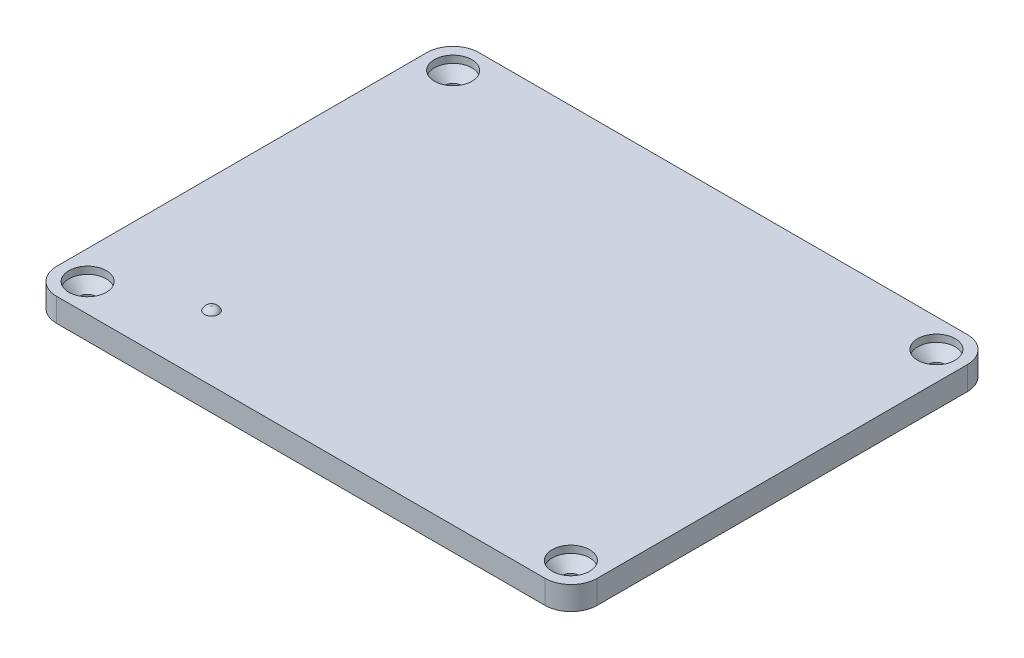
from build123d import *

# Parameters (mm, degrees)
SKETCH1_W           = 115.189
SKETCH1_H           = 89.9922
BOSS_EXTRUDE1_DEPTH = 5.0038
CUT_EXTRUDE1_DEPTH  = 2.54
SKETCH3_R           = 3.3655
CUT_EXTRUDE2_DEPTH  = 2.54
FILLET1_R           = 5.5626
SKETCH6_R           = 4.0005
CUT_EXTRUDE3_DEPTH  = 1.524
SKETCH7_R           = 1.905
CUT_EXTRUDE4_DEPTH  = 1.27
CUT_EXTRUDE5_DEPTH  = 2.54
SKETCH9_R           = 1.4859
CUT_EXTRUDE6_DEPTH  = 74.258538478
SKETCH11_R          = 2.032
BOSS_EXTRUDE2_DEPTH = 0.762
BOSS_EXTRUDE3_START = 3.302
SKETCH13_R          = 1.4859
BOSS_EXTRUDE3_DEPTH = 3.302
FILLET2_R           = 1.4859


with BuildPart() as part:
    # Sketch1 → Boss-Extrude1 (new body)
    with BuildSketch(Plane(origin=(0, 0, 0), x_dir=(1, 0, 0), z_dir=(0, 1, 0))):
        Rectangle(SKETCH1_W, SKETCH1_H)
    extrude(amount=BOSS_EXTRUDE1_DEPTH)

    # Sketch2 → Cut-Extrude1 (cut)
    with BuildSketch(Plane.XZ):
        with BuildLine():
            Line((-41.8973, 39.8653), (41.8973, 39.8653))
            ThreePointArc((41.8973, 39.8653), (42.346312806, 39.679312806), (42.5323, 39.2303))
            Line((42.5323, 39.2303), (42.5323, 38.9509))
            ThreePointArc((42.5323, 38.9509), (45.039407374, 32.898207374), (51.0921, 30.3911))
            Line((51.0921, 30.3911), (51.8287, 30.3911))
            ThreePointArc((51.8287, 30.3911), (52.277712806, 30.205112806), (52.4637, 29.7561))
            Line((52.4637, 29.7561), (52.4637, -20.5105))
            ThreePointArc((52.4637, -20.5105), (52.277712806, -20.959512806), (51.8287, -21.1455))
            Line((51.8287, -21.1455), (51.2445, -21.1455))
            ThreePointArc((51.2445, -21.1455), (45.084044301, -23.697244301), (42.5323, -29.8577))
            Line((42.5323, -29.8577), (42.5323, -39.2303))
            ThreePointArc((42.5323, -39.2303), (42.346312806, -39.679312806), (41.8973, -39.8653))
            Line((41.8973, -39.8653), (-41.8973, -39.8653))
            ThreePointArc((-41.8973, -39.8653), (-42.346312806, -39.679312806), (-42.5323, -39.2303))
            Line((-42.5323, -39.2303), (-42.5323, -38.9509))
            ThreePointArc((-42.5323, -38.9509), (-45.039407374, -32.898207374), (-51.0921, -30.3911))
            Line((-51.0921, -30.3911), (-51.8287, -30.3911))
            ThreePointArc((-51.8287, -30.3911), (-52.277712806, -30.205112806), (-52.4637, -29.7561))
            Line((-52.4637, -29.7561), (-52.4637, 20.5105))
            ThreePointArc((-52.4637, 20.5105), (-52.277712806, 20.959512806), (-51.8287, 21.1455))
            Line((-51.8287, 21.1455), (-51.2445, 21.1455))
            ThreePointArc((-51.2445, 21.1455), (-45.084044301, 23.697244301), (-42.5323, 29.8577))
            Line((-42.5323, 29.8577), (-42.5323, 39.2303))
            ThreePointArc((-42.5323, 39.2303), (-42.346312806, 39.679312806), (-41.8973, 39.8653))
        make_face()
    extrude(amount=-CUT_EXTRUDE1_DEPTH, mode=Mode.SUBTRACT)

    # Sketch3 → Cut-Extrude2 (cut)
    with BuildSketch(Plane(origin=(0, 0, 0), x_dir=(-1, 0, 0), z_dir=(0, -1, 0))):
        with Locations(Location((51.4985, -29.8577, 0), (0, 0, 90))):
            Circle(SKETCH3_R)
        with Locations(Location((-51.4985, 29.8577, 0), (0, 0, 90))):
            Circle(SKETCH3_R)
    extrude(amount=-CUT_EXTRUDE2_DEPTH, mode=Mode.SUBTRACT)

    # Fillet1
    fillet1_edges = [part.edges().sort_by_distance(p)[0] for p in [
        (57.5945, 2.5019, 44.9961),
        (-57.5945, 2.5019, 44.9961),
        (-57.5945, 2.5019, -44.9961),
        (57.5945, 2.5019, -44.9961),
    ]]
    fillet(fillet1_edges, radius=FILLET1_R)

    # Sketch6 → Cut-Extrude3 (cut)
    with BuildSketch(Plane(origin=(0, 5.0038, 0), x_dir=(1, 0, 0), z_dir=(0, 1, 0))):
        with Locations(Location((-51.4985, 38.9509, 0), (0, 0, 270))):
            Circle(SKETCH6_R)
        with Locations(Location((51.4985, 38.9509, 0), (0, 0, 270))):
            Circle(SKETCH6_R)
        with Locations(Location((51.4985, -38.9509, 0), (0, 0, 270))):
            Circle(SKETCH6_R)
        with Locations(Location((-51.4985, -38.9509, 0), (0, 0, 270))):
            Circle(SKETCH6_R)
    extrude(amount=-CUT_EXTRUDE3_DEPTH, mode=Mode.SUBTRACT)

    # Sketch7 → Cut-Extrude4 (cut)
    with BuildSketch(Plane.XZ):
        with Locations(Location((51.4985, 38.9509, 0), (0, 0, 270))):
            Circle(SKETCH7_R)
        with Locations(Location((51.4985, -38.9509, 0), (0, 0, 270))):
            Circle(SKETCH7_R)
        with Locations(Location((-51.4985, -38.9509, 0), (0, 0, 270))):
            Circle(SKETCH7_R)
        with Locations(Location((-51.4985, 38.9509, 0), (0, 0, 270))):
            Circle(SKETCH7_R)
    extrude(amount=-CUT_EXTRUDE4_DEPTH, mode=Mode.SUBTRACT)

    # Cut-Loft1: read off the stored shape, not the designer's step
    # Cut-Loft1: loft between two sections, ruled curve by curve
    cut_loft1_from = [
        Edge.make_bspline([(52.959489648, 3.4798, -35.226720963), (45.511131575, 3.4798, -32.304741666), (42.589152278, 3.4798, -39.75309974), (50.037510352, 3.4798, -42.675079037), (57.485868425, 3.4798, -45.597058334), (60.407847722, 3.4798, -38.14870026), (52.959489648, 3.4798, -35.226720963)], [0, 0, 0, 0, 0.5, 0.5, 0.5, 1, 1, 1, 1], 3, [1, 0.333333333, 0.333333333, 1, 0.333333333, 0.333333333, 1]),
    ]
    cut_loft1_to = [
        Edge.make_bspline([(52.685846968, 1.27, -37.461191244), (49.706429455, 1.27, -35.086497308), (47.33173552, 1.27, -38.065914821), (50.311153032, 1.27, -40.440608756), (53.290570545, 1.27, -42.815302692), (55.66526448, 1.27, -39.835885179), (52.685846968, 1.27, -37.461191244)], [0, 0, 0, 0, 0.5, 0.5, 0.5, 1, 1, 1, 1], 3, [1, 0.333333333, 0.333333333, 1, 0.333333333, 0.333333333, 1]),
    ]
    cut_loft1 = Solid(Shell([*[Face.make_surface_from_curves(cut_loft1_from[k], cut_loft1_to[k]) for k in range(1)], Face(Wire(cut_loft1_from)), Face(Wire(cut_loft1_to))]))
    add(cut_loft1, mode=Mode.SUBTRACT)

    # loft up to a face of the part (cut_loft2)
    loft([Face(Wire([part.edges().sort_by_distance((54.414738994, 3.4798, 36.212369303))[0]])), Face(Wire([part.edges().sort_by_distance((52.887185235, 1.27, 40.254962237))[0]]))], mode=Mode.SUBTRACT)

    # loft up to a face of the part (cut_loft3)
    loft([Face(Wire([part.edges().sort_by_distance((-48.582261006, 3.4798, -41.689430697))[0]])), Face(Wire([part.edges().sort_by_distance((-50.109814765, 1.27, -37.646837763))[0]]))], mode=Mode.SUBTRACT)

    # loft up to a face of the part (cut_loft4)
    loft([Face(Wire([part.edges().sort_by_distance((-48.582261006, 3.4798, 36.212369303))[0]])), Face(Wire([part.edges().sort_by_distance((-50.109814765, 1.27, 40.254962237))[0]]))], mode=Mode.SUBTRACT)

    # Sketch8 → Cut-Extrude5 (cut)
    with BuildSketch(Plane.XZ):
        with BuildLine():
            Line((-56.2737, 20.5105), (-56.2737, -29.7561))
            ThreePointArc((-56.2737, -29.7561), (-54.971789642, -32.899189642), (-51.8287, -34.2011))
            Line((-51.8287, -34.2011), (-51.0921, -34.2011))
            ThreePointArc((-51.0921, -34.2011), (-47.733484211, -35.592284211), (-46.3423, -38.9509))
            Line((-46.3423, -38.9509), (-46.3423, -39.2303))
            ThreePointArc((-46.3423, -39.2303), (-45.040389642, -42.373389642), (-41.8973, -43.6753))
            Line((-41.8973, -43.6753), (41.8973, -43.6753))
            ThreePointArc((41.8973, -43.6753), (45.040389642, -42.373389642), (46.3423, -39.2303))
            Line((46.3423, -39.2303), (46.3423, -29.8577))
            ThreePointArc((46.3423, -29.8577), (47.778121137, -26.391321137), (51.2445, -24.9555))
            Line((51.2445, -24.9555), (51.8287, -24.9555))
            ThreePointArc((51.8287, -24.9555), (54.971789642, -23.653589642), (56.2737, -20.5105))
            Line((56.2737, -20.5105), (56.2737, 29.7561))
            ThreePointArc((56.2737, 29.7561), (54.971789642, 32.899189642), (51.8287, 34.2011))
            Line((51.8287, 34.2011), (51.0921, 34.2011))
            ThreePointArc((51.0921, 34.2011), (47.733484211, 35.592284211), (46.3423, 38.9509))
            Line((46.3423, 38.9509), (46.3423, 39.2303))
            ThreePointArc((46.3423, 39.2303), (45.040389642, 42.373389642), (41.8973, 43.6753))
            Line((41.8973, 43.6753), (-41.8973, 43.6753))
            ThreePointArc((-41.8973, 43.6753), (-45.040389642, 42.373389642), (-46.3423, 39.2303))
            Line((-46.3423, 39.2303), (-46.3423, 29.8577))
            ThreePointArc((-46.3423, 29.8577), (-47.778121137, 26.391321137), (-51.2445, 24.9555))
            Line((-51.2445, 24.9555), (-51.8287, 24.9555))
            ThreePointArc((-51.8287, 24.9555), (-54.971789642, 23.653589642), (-56.2737, 20.5105))
        make_face()
        with BuildLine():
            Line((-53.7337, 20.5105), (-53.7337, -29.7561))
            ThreePointArc((-53.7337, -29.7561), (-53.175738418, -31.103138418), (-51.8287, -31.6611))
            Line((-51.8287, -31.6611), (-51.0921, -31.6611))
            ThreePointArc((-51.0921, -31.6611), (-45.937432987, -33.796232987), (-43.8023, -38.9509))
            Line((-43.8023, -38.9509), (-43.8023, -39.2303))
            ThreePointArc((-43.8023, -39.2303), (-43.244338418, -40.577338418), (-41.8973, -41.1353))
            Line((-41.8973, -41.1353), (41.8973, -41.1353))
            ThreePointArc((41.8973, -41.1353), (43.244338418, -40.577338418), (43.8023, -39.2303))
            Line((43.8023, -39.2303), (43.8023, -29.8577))
            ThreePointArc((43.8023, -29.8577), (45.982069913, -24.595269913), (51.2445, -22.4155))
            Line((51.2445, -22.4155), (51.8287, -22.4155))
            ThreePointArc((51.8287, -22.4155), (53.175738418, -21.857538418), (53.7337, -20.5105))
            Line((53.7337, -20.5105), (53.7337, 29.7561))
            ThreePointArc((53.7337, 29.7561), (53.175738418, 31.103138418), (51.8287, 31.6611))
            Line((51.8287, 31.6611), (51.0921, 31.6611))
            ThreePointArc((51.0921, 31.6611), (45.937432987, 33.796232987), (43.8023, 38.9509))
            Line((43.8023, 38.9509), (43.8023, 39.2303))
            ThreePointArc((43.8023, 39.2303), (43.244338418, 40.577338418), (41.8973, 41.1353))
            Line((41.8973, 41.1353), (-41.8973, 41.1353))
            ThreePointArc((-41.8973, 41.1353), (-43.244338418, 40.577338418), (-43.8023, 39.2303))
            Line((-43.8023, 39.2303), (-43.8023, 29.8577))
            ThreePointArc((-43.8023, 29.8577), (-45.982069913, 24.595269913), (-51.2445, 22.4155))
            Line((-51.2445, 22.4155), (-51.8287, 22.4155))
            ThreePointArc((-51.8287, 22.4155), (-53.175738418, 21.857538418), (-53.7337, 20.5105))
        make_face(mode=Mode.SUBTRACT)
    extrude(amount=-CUT_EXTRUDE5_DEPTH, mode=Mode.SUBTRACT)

    # Sketch9 → Cut-Extrude6 (cut, through all)
    with BuildSketch(Plane(origin=(0, 5.0038, 0), x_dir=(1, 0, 0), z_dir=(0, 1, 0))):
        with Locations(Location((-32.9311, -31.1023, 0), (0, 0, 270))):
            Circle(SKETCH9_R)
    extrude(amount=-CUT_EXTRUDE6_DEPTH, mode=Mode.SUBTRACT)



with BuildPart() as body_2:
    # Sketch11 → Boss-Extrude2 (new body)
    with BuildSketch(Plane(origin=(0, 1.778, 0), x_dir=(-1, 0, 0), z_dir=(0, -1, 0))):
        with Locations(Location((32.9311, -31.1023, 0), (0, 0, 90))):
            Circle(SKETCH11_R)
    extrude(amount=-BOSS_EXTRUDE2_DEPTH)


with BuildPart() as part_1:
    add(part.part)

    add(body_2.part)  # Boss-Extrude3 merges body 2
    # Sketch13 → Boss-Extrude3 (add)
    with BuildSketch(Plane(origin=(0, 2.54, 0), x_dir=(1, 0, 0), z_dir=(0, 1, 0)).offset(BOSS_EXTRUDE3_START)):
        with Locations(Location((-32.9311, -31.1023, 0), (0, 0, 90))):
            Circle(SKETCH13_R)
    extrude(amount=-BOSS_EXTRUDE3_DEPTH)

    # Fillet2
    # the kernel refuses this fillet: 1.4859 mm, written as the material it takes off along each edge
    with BuildSketch(Plane(origin=(-32.9311, 5.842, 31.1023), x_dir=(0, 0, -1), z_dir=(1, 0, 0))) as fillet2_piece_1:
        with BuildLine():
            CenterArc((0.148595427, -1.4859), FILLET2_R, 25.842412874, 64.157587126)
            Line((0.148595427, 0), (0.148595427, 0.029718))
            Line((0.148595427, 0.029718), (1.4859, 0.029718))
            Line((1.4859, 0.029718), (1.515618, 0))
            ThreePointArc((1.515618, 0), (1.515618, -0.4191), (1.512646091, -0.825246))
            Line((1.512646091, -0.825246), (1.4859, -0.8382))
        make_face()
    revolve(axis=Axis((-32.9311, 5.842, 31.1023), (0, 1, 0)), mode=Mode.SUBTRACT)


solid = part_1.part
